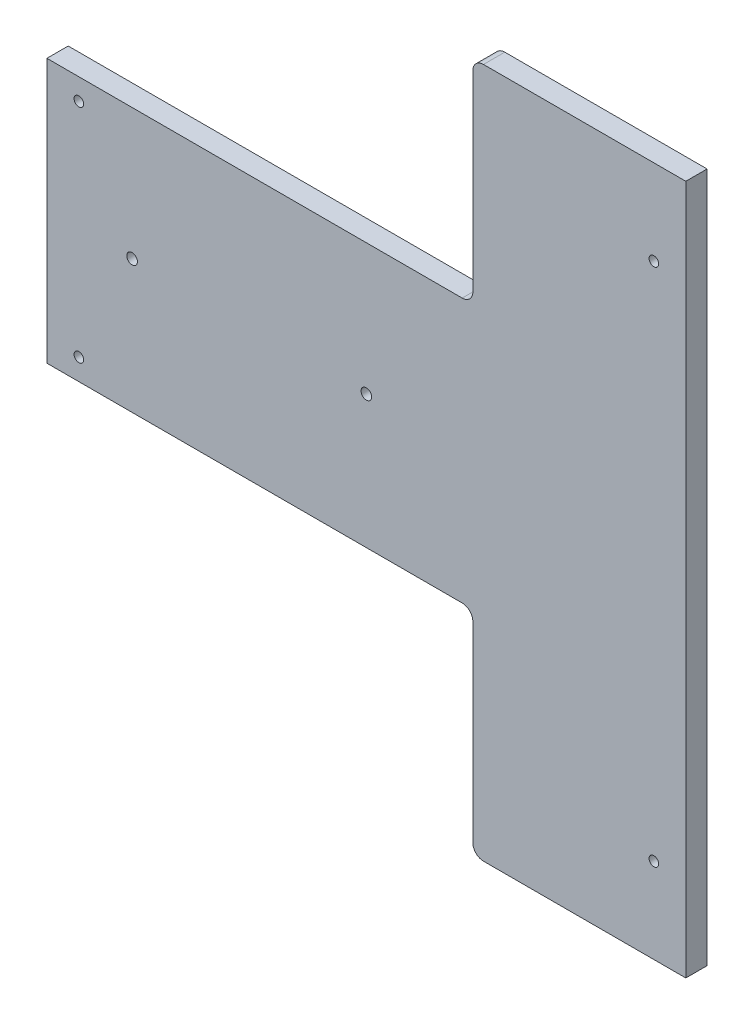
from build123d import *

# Parameters (mm, degrees)
BOSS_EXTRU_1_DEPTH      = 10
ESQUISSE2_R             = 2.25
ENL_V_MAT_EXTRU_1_DEPTH = 10
ESQUISSE3_R             = 2.5
ENL_V_MAT_EXTRU_2_DEPTH = 10
CONG_1_R                = 5


with BuildPart() as part:
    # Esquisse1 → Boss.-Extru.1 (new body)
    with BuildSketch(Plane.XY):
        Polygon((77.555428531, 41.935483871), (-122.444571469, 41.935483871), (-122.444571469, -82.064516129), (77.555428531, -82.064516129), (77.555428531, -182.064516129), (177.555428531, -182.064516129), (177.555428531, 141.935483871), (77.555428531, 141.935483871), align=None)
    extrude(amount=BOSS_EXTRU_1_DEPTH)

    # Esquisse2 → Enlèv. mat.-Extru.1 (cut)
    with BuildSketch(Plane(origin=(0, 0, 0), x_dir=(-1, 0, 0), z_dir=(0, 0, -1))):
        with Locations((-162.555428531, -142.064516129)):
            Circle(ESQUISSE2_R)
        with Locations((-162.555428531, 101.935483871)):
            Circle(ESQUISSE2_R)
        with Locations((107.444571469, 31.935483871)):
            Circle(ESQUISSE2_R)
        with Locations((107.444571469, -72.064516129)):
            Circle(ESQUISSE2_R)
    extrude(amount=-ENL_V_MAT_EXTRU_1_DEPTH, mode=Mode.SUBTRACT)

    # Esquisse3 → Enlèv. mat.-Extru.2 (cut)
    with BuildSketch(Plane(origin=(0, 0, 0), x_dir=(-1, 0, 0), z_dir=(0, 0, -1))):
        with Locations((-27.555428531, -19.564516129)):
            Circle(ESQUISSE3_R)
        with Locations((82.444571469, -19.564516129)):
            Circle(ESQUISSE3_R)
    extrude(amount=-ENL_V_MAT_EXTRU_2_DEPTH, mode=Mode.SUBTRACT)

    # Congé1
    cong_1_edges = [part.edges().sort_by_distance(p)[0] for p in [
        (77.555428531, 141.935483871, 5),
        (77.555428531, 41.935483871, 5),
        (77.555428531, -82.064516129, 5),
        (77.555428531, -182.064516129, 5),
    ]]
    fillet(cong_1_edges, radius=CONG_1_R)


solid = part.part
